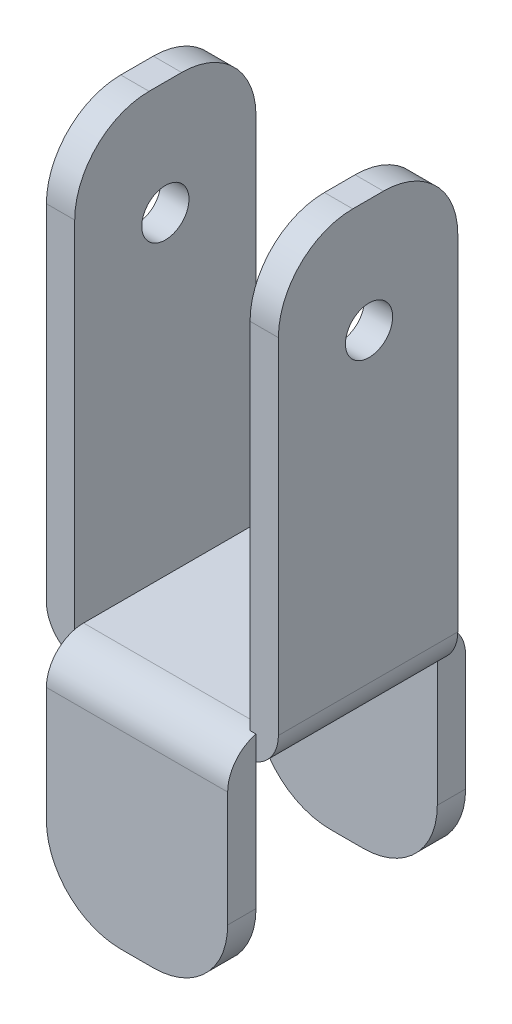
from build123d import *

# Parameters (mm, degrees)
BOSS_EXTRUDE1_DEPTH         = 3.81
SKETCH2_W                   = 27.394147034
SKETCH2_H                   = 24.384
BOSS_EXTRUDE2_DEPTH         = 3.81
SKETCH7_W                   = 24.13
SKETCH7_H                   = 61.344873393
BOSS_EXTRUDE3_DEPTH         = 3.81
FILLET1_R                   = 10
FILLET2_R                   = 10
FILLET3_R                   = 5
FILLET4_R                   = 5
SKETCH8_W                   = 24.384
SKETCH8_H                   = 30.48
BOSS_EXTRUDE4_DEPTH         = 3.81
FILLET5_R                   = 5
FILLET6_R                   = 10
FILLET8_R                   = 10
SKETCH9_W                   = 24.384
SKETCH9_H                   = 30.48
BOSS_EXTRUDE5_DEPTH         = 3.81
FILLET9_R                   = 10
FILLET10_R                  = 10
FILLET11_R                  = 5
F_1_4_0_25_DIAMETER_HOLE1_D = 6.35


with BuildPart() as part:
    # Sketch1 → Boss-Extrude1 (new body)
    with BuildSketch(Plane(origin=(0, 0, 0), x_dir=(0, 0, -1), z_dir=(1, 0, 0))):
        with BuildLine():
            Line((10, 0), (14.384, 0))
            ThreePointArc((14.384, 0), (21.455067812, -2.928932188), (24.384, -10))
            Line((24.384, -10), (24.384, -57.534873393))
            Line((24.384, -57.534873393), (0, -57.534873393))
            Line((0, -57.534873393), (0, -10))
            ThreePointArc((0, -10), (2.928932188, -2.928932188), (10, 0))
        make_face()
    extrude(amount=BOSS_EXTRUDE1_DEPTH)

    # Sketch2 → Boss-Extrude2 (add)
    with BuildSketch(Plane(origin=(0, -57.534873393, 0), x_dir=(-1, 0, 0), z_dir=(0, -1, 0))):
        with Locations((-13.697073517, 12.192)):
            Rectangle(SKETCH2_W, SKETCH2_H)
    extrude(amount=BOSS_EXTRUDE2_DEPTH)

    # Sketch7 → Boss-Extrude3 (add)
    with BuildSketch(Plane(origin=(27.394147034, 0, 0), x_dir=(0, 0, -1), z_dir=(1, 0, 0))):
        with Locations((12.065, -30.672436697)):
            Rectangle(SKETCH7_W, SKETCH7_H)
    extrude(amount=BOSS_EXTRUDE3_DEPTH)

    # Fillet1
    fillet1_edges = [part.edges().sort_by_distance(p)[0] for p in [
        (29.299147034, 0, -24.13),
    ]]
    fillet(fillet1_edges, radius=FILLET1_R)

    # Fillet2
    fillet2_edges = [part.edges().sort_by_distance(p)[0] for p in [
        (29.299147034, 0, 0),
    ]]
    fillet(fillet2_edges, radius=FILLET2_R)

    # Fillet3
    fillet3_edges = [part.edges().sort_by_distance(p)[0] for p in [
        (31.204147034, -61.344873393, -12.065),
    ]]
    fillet(fillet3_edges, radius=FILLET3_R)

    # Fillet4
    fillet4_edges = [part.edges().sort_by_distance(p)[0] for p in [
        (0, -61.344873393, -12.192),
    ]]
    fillet(fillet4_edges, radius=FILLET4_R)

    # Sketch8 → Boss-Extrude4 (add)
    with BuildSketch(Plane(origin=(0, 0, -24.384), x_dir=(-1, 0, 0), z_dir=(0, 0, -1))):
        with Locations((-16.002, -72.933007505)):
            Rectangle(SKETCH8_W, SKETCH8_H)
    extrude(amount=BOSS_EXTRUDE4_DEPTH)

    # Fillet5
    # the kernel refuses this fillet: 5 mm, written as the material it takes off along each edge
    with BuildSketch(Plane(origin=(-8.330814429, -57.693007505, -28.194), x_dir=(0, 0, 1), z_dir=(1, 0, 0))) as fillet5_piece_1:
        with BuildLine():
            CenterArc((5, 4.856325772), FILLET5_R, 180, 76.231471248)
            Line((0, 4.856325772), (-0.1, 4.856325772))
            Line((-0.1, 4.856325772), (-0.1, 0))
            Line((-0.1, 0), (0, -0.1))
            ThreePointArc((0, -0.1), (1.905, -0.1), (3.7862, -0.097126515))
            Line((3.7862, -0.097126515), (3.81, 0))
        make_face()
    extrude(amount=48.665628858, mode=Mode.SUBTRACT)

    # Fillet6
    fillet6_edges = [part.edges().sort_by_distance(p)[0] for p in [
        (3.81, -88.173007505, -26.289),
    ]]
    fillet(fillet6_edges, radius=FILLET6_R)

    # Fillet8
    fillet8_edges = [part.edges().sort_by_distance(p)[0] for p in [
        (28.194, -88.173007505, -26.289),
    ]]
    fillet(fillet8_edges, radius=FILLET8_R)

    # Sketch9 → Boss-Extrude5 (add)
    with BuildSketch(Plane.XY):
        with Locations((16.002, -72.774873393)):
            Rectangle(SKETCH9_W, SKETCH9_H)
    extrude(amount=BOSS_EXTRUDE5_DEPTH)

    # Fillet9
    fillet9_edges = [part.edges().sort_by_distance(p)[0] for p in [
        (3.81, -88.014873393, 1.905),
    ]]
    fillet(fillet9_edges, radius=FILLET9_R)

    # Fillet10
    fillet10_edges = [part.edges().sort_by_distance(p)[0] for p in [
        (28.194, -88.014873393, 1.905),
    ]]
    fillet(fillet10_edges, radius=FILLET10_R)

    # Fillet11
    # the kernel refuses this fillet: 5 mm, written as the material it takes off along each edge
    with BuildSketch(Plane(origin=(3.81, -57.534873393, 3.81), x_dir=(0, -1, 0), z_dir=(1, 0, 0))) as fillet11_piece_1_section:
        with BuildLine():
            CenterArc((FILLET11_R, FILLET11_R), FILLET11_R, 180, 90)
            Line((0, FILLET11_R), (0, 0))
            Line((0, 0), (FILLET11_R, 0))
        make_face()
    fillet11_piece_1 = extrude(amount=36.884, mode=Mode.PRIVATE)
    fillet11_piece_1 = split(fillet11_piece_1, bisect_by=Plane(origin=(27.394147034, -58.779272815, 2.781917075), z_dir=(-1, 0, 0)), keep=Keep.TOP, mode=Mode.PRIVATE)
    add(fillet11_piece_1, mode=Mode.SUBTRACT)
    with BuildSketch(Plane(origin=(-8.69, -57.534873393, 3.81), x_dir=(0, -1, 0), z_dir=(1, 0, 0))) as fillet11_piece_2_section:
        with BuildLine():
            CenterArc((FILLET11_R, FILLET11_R), FILLET11_R, 180, 90)
            Line((0, FILLET11_R), (0, 0))
            Line((0, 0), (FILLET11_R, 0))
        make_face()
    fillet11_piece_2 = extrude(amount=49.384, mode=Mode.PRIVATE)
    fillet11_piece_2 = split(fillet11_piece_2, bisect_by=Plane(origin=(27.831342884, -61.431899575, 0), z_dir=(0, 0, 1)), keep=Keep.TOP, mode=Mode.PRIVATE)
    add(fillet11_piece_2, mode=Mode.SUBTRACT)

    # 1/4 (0.25) Diameter Hole1 (through all)
    with Locations(Plane(origin=(0, -15.24, -12.192), x_dir=(0, 0, -1), z_dir=(-1, 0, 0))):
        with Locations((0, 0)):
            Hole(F_1_4_0_25_DIAMETER_HOLE1_D / 2)


solid = part.part
